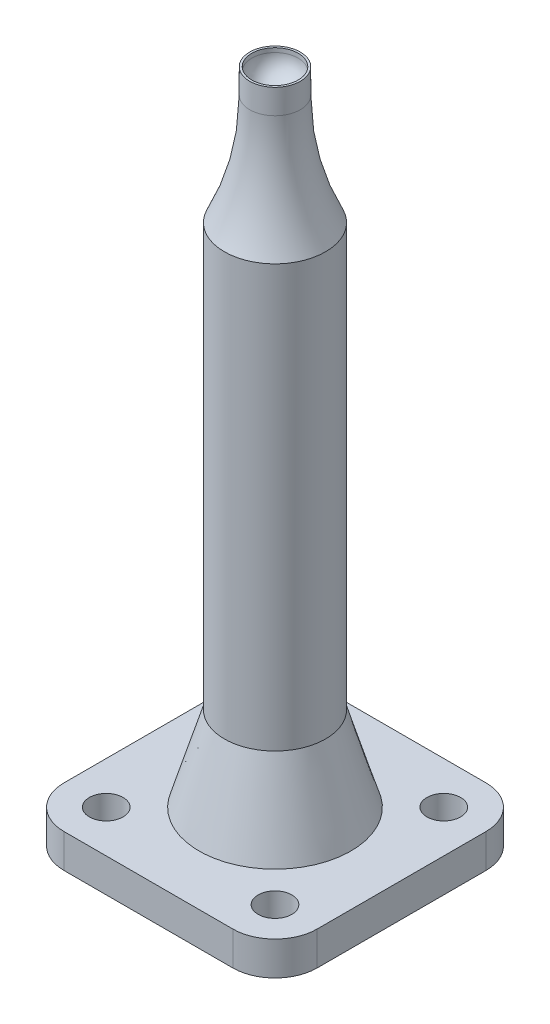
from build123d import *

# Parameters (mm, degrees)
SKETCH_1_W          = 30
SKETCH_1_H          = 30
SKETCH_1_R          = 2
EXTRUDE_1_DEPTH     = 4
FILLET_1_R          = 5
SKETCH_2_R          = 6
EXTRUDE_2_DEPTH     = 60
SKETCH_3_R          = 3
EXTRUDE_3_DEPTH     = 16
FILLET_2_R          = 30
SKETCH_4_R          = 2.75
CUT_EXTRUDE_1_DEPTH = 3
FILLET_3_R          = 2.5
CHAMFER_4_SIZE      = 10
CHAMFER_4_SIZE2     = 3


with BuildPart() as part:
    # Эскиз1 → Бобышка-Вытянуть1 (new body)
    with BuildSketch(Plane(origin=(0, 0, 0), x_dir=(1, 0, 0), z_dir=(0, 1, 0))):
        Rectangle(SKETCH_1_W, SKETCH_1_H)
        with Locations(Location((-10, 10, 0), (0, 0, 270))):
            Circle(SKETCH_1_R, mode=Mode.SUBTRACT)
        with Locations(Location((10, 10, 0), (0, 0, 270))):
            Circle(SKETCH_1_R, mode=Mode.SUBTRACT)
        with Locations(Location((10, -10, 0), (0, 0, 270))):
            Circle(SKETCH_1_R, mode=Mode.SUBTRACT)
        with Locations(Location((-10, -10, 0), (0, 0, 270))):
            Circle(SKETCH_1_R, mode=Mode.SUBTRACT)
    extrude(amount=EXTRUDE_1_DEPTH)

    # Скругление1
    fillet_1_edges = [part.edges().sort_by_distance(p)[0] for p in [
        (15, 2, 15),
        (-15, 2, 15),
        (-15, 2, -15),
        (15, 2, -15),
    ]]
    fillet(fillet_1_edges, radius=FILLET_1_R)

    # Эскиз2 → Бобышка-Вытянуть2 (add)
    with BuildSketch(Plane(origin=(0, 4, 0), x_dir=(1, 0, 0), z_dir=(0, 1, 0))):
        with Locations(Location((0, 0, 0), (0, 0, 270))):
            Circle(SKETCH_2_R)
    extrude(amount=EXTRUDE_2_DEPTH)

    # Эскиз3 → Бобышка-Вытянуть3 (add)
    with BuildSketch(Plane(origin=(0, 64, 0), x_dir=(1, 0, 0), z_dir=(0, 1, 0))):
        with Locations(Location((0, 0, 0), (0, 0, 270))):
            Circle(SKETCH_3_R)
    extrude(amount=EXTRUDE_3_DEPTH)

    # Скругление2
    # the kernel refuses this fillet: 30 mm, written as the material it adds along each edge
    with BuildSketch(Plane(origin=(0, 64, 0), x_dir=(0, 0, 1), z_dir=(-1, 0, 0))) as fillet_2_piece_1:
        with BuildLine():
            CenterArc((33, 13.076696831), FILLET_2_R, 180, 25.841932763)
            Line((3, 13.076696831), (2.4, 13.076696831))
            Line((2.4, 13.076696831), (2.4, 0))
            Line((2.4, 0), (3, -0.6))
            ThreePointArc((3, -0.6), (4.5, -0.6), (5.46, -0.261533937))
            Line((5.46, -0.261533937), (6, 0))
        make_face()
    revolve(axis=Axis((0, 64, 0), (0, 1, 0)))

    # Эскиз4 → Вырез-Вытянуть1 (cut)
    with BuildSketch(Plane(origin=(0, 80, 0), x_dir=(1, 0, 0), z_dir=(0, 1, 0))):
        with Locations(Location((0, 0, 0), (0, 0, 270))):
            Circle(SKETCH_4_R)
    extrude(amount=-CUT_EXTRUDE_1_DEPTH, mode=Mode.SUBTRACT)

    # Скругление3
    fillet_3_edges = [part.edges().sort_by_distance(p)[0] for p in [
        (0, 77, -2.75),
    ]]
    fillet(fillet_3_edges, radius=FILLET_3_R)

    # Chamfer 4
    chamfer_4_edges = [part.edges().sort_by_distance(p)[0] for p in [
        (0, 4, -6),
    ]]
    chamfer_4_side = [part.faces().sort_by_distance(p)[0] for p in [
        (0, 34, -6),
    ]]
    chamfer(chamfer_4_edges, length=CHAMFER_4_SIZE, length2=CHAMFER_4_SIZE2, reference=chamfer_4_side[0])


solid = part.part
